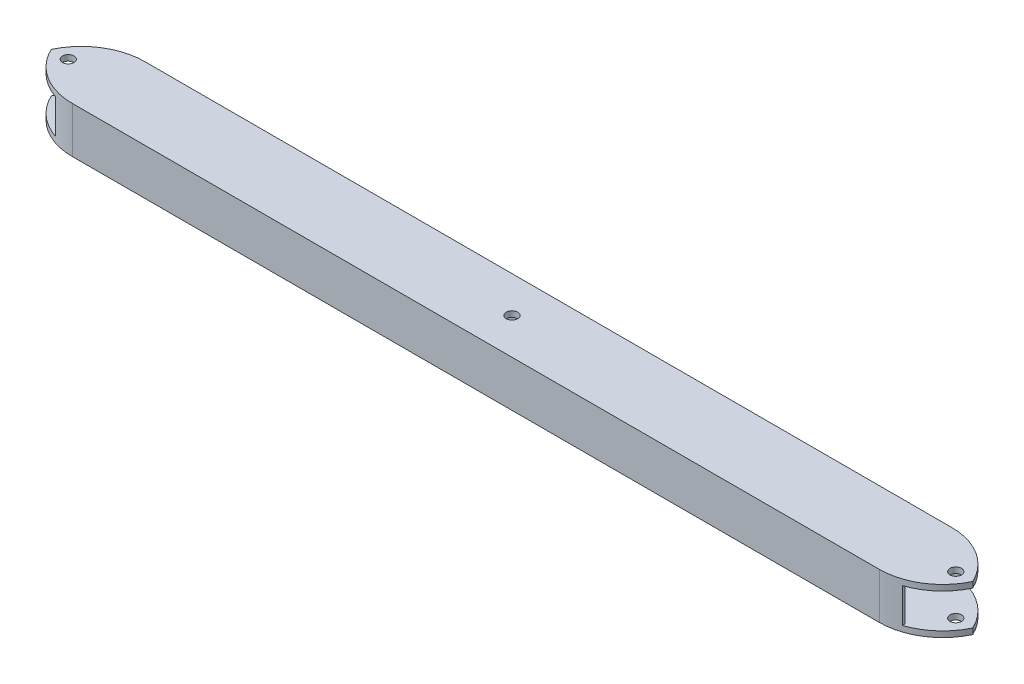
from build123d import *

# Parameters (mm, degrees)
SKETCH1_W           = 515.5
SKETCH1_H           = 40
SKETCH1_R           = 3.175
BOSS_EXTRUDE1_DEPTH = 25.4
CUT_EXTRUDE1_REACH  = 519.673
SKETCH2_W           = 33.65
SKETCH2_H           = 19.05
SKETCH4_W           = 40
SKETCH4_H           = 19.05
CUT_EXTRUDE2_DEPTH  = 24
FILLET1_R           = 35


with BuildPart() as part:
    # Sketch1 → Boss-Extrude1 (new body)
    with BuildSketch(Plane(origin=(0, 0, 0), x_dir=(1, 0, 0), z_dir=(0, 1, 0))):
        with Locations((257.75, -20)):
            Rectangle(SKETCH1_W, SKETCH1_H)
        with Locations(Location((257.75, -20, 0), (0, 0, 270))):
            Circle(SKETCH1_R, mode=Mode.SUBTRACT)
        with Locations(Location((12.78, -20, 0), (0, 0, 270))):
            Circle(SKETCH1_R, mode=Mode.SUBTRACT)
        with Locations(Location((502.72, -20, 0), (0, 0, 90))):
            Circle(SKETCH1_R, mode=Mode.SUBTRACT)
    extrude(amount=BOSS_EXTRUDE1_DEPTH)

    # Cut-Extrude1: up to this face of the body (flat: up to its plane)
    cut_extrude1_end = Plane(part.part.faces().sort_by_distance((515.5, 12.7, 20))[0])
    # Sketch2 → Cut-Extrude1 (cut, up to the picked face)
    with BuildSketch(Plane.ZY, mode=Mode.PRIVATE) as cut_extrude1_sk1:
        with Locations((20, 12.7)):
            Rectangle(SKETCH2_W, SKETCH2_H)
    cut_extrude1_tool1 = split(extrude(cut_extrude1_sk1.sketch, amount=-CUT_EXTRUDE1_REACH, mode=Mode.PRIVATE), bisect_by=cut_extrude1_end, keep=Keep.BOTH, mode=Mode.PRIVATE)
    add(cut_extrude1_tool1.solids().sort_by(Axis((0, 12.7, 20), (1, 0, 0)))[0], mode=Mode.SUBTRACT)

    # Sketch4 → Cut-Extrude2 (cut)
    with BuildSketch(Plane.ZY):
        with Locations((20, 12.7)):
            Rectangle(SKETCH4_W, SKETCH4_H)
    cut_extrude2 = extrude(amount=-CUT_EXTRUDE2_DEPTH, mode=Mode.SUBTRACT)

    # Mirror1: Cut-Extrude2 across plane
    add(cut_extrude2.mirror(Plane.ZY.offset(-257.75)), mode=Mode.SUBTRACT)

    # Fillet1
    # the kernel refuses this fillet: 35 mm, written as the material it takes off along each edge
    with BuildSketch(Plane(origin=(515.5, -65.275, 0), x_dir=(-1, 0, 0), z_dir=(0, 1, 0)), Plane(origin=(0, -65.275, 40), x_dir=(1, 0, 0), z_dir=(0, 1, 0))) as fillet1_piece_1:
        with BuildLine():
            CenterArc((FILLET1_R, FILLET1_R), FILLET1_R, 180, 90)
            Line((0, FILLET1_R), (0, 0))
            Line((0, 0), (FILLET1_R, 0))
        make_face()
    extrude(amount=178.175, mode=Mode.SUBTRACT)
    with BuildSketch(Plane(origin=(515.5, -65.275, 40), x_dir=(-1, 0, 0), z_dir=(0, 1, 0)), Plane(origin=(0, -65.275, 0), x_dir=(1, 0, 0), z_dir=(0, 1, 0))) as fillet1_piece_2:
        with BuildLine():
            CenterArc((FILLET1_R, -FILLET1_R), FILLET1_R, 90, 90)
            Line((0, -FILLET1_R), (0, 0))
            Line((0, 0), (FILLET1_R, 0))
        make_face()
    extrude(amount=178.175, mode=Mode.SUBTRACT)


solid = part.part
